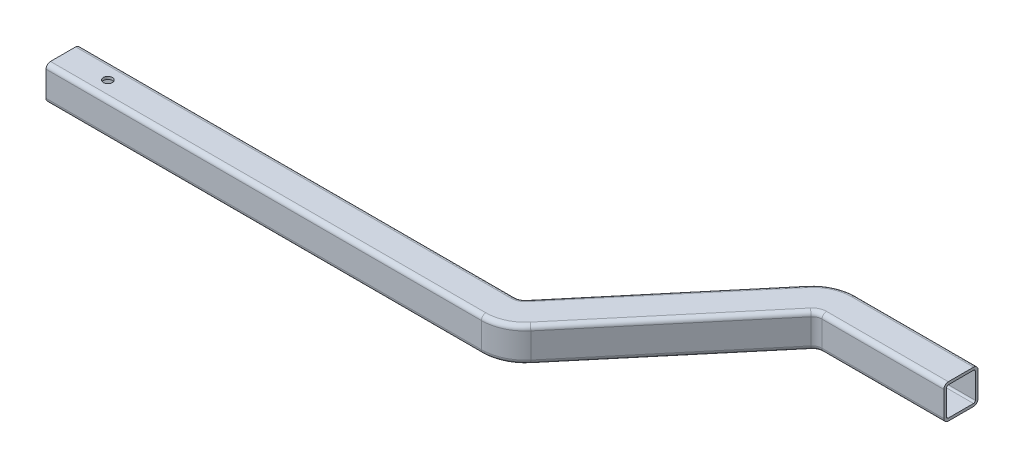
from build123d import *

# Parameters (mm, degrees)
CUT_EXTRUDE3_DEPTH      = 838.811644413
CUT_EXTRUDE3_DEPTH_BACK = 838.811644413
SKETCH21_R              = 5


with BuildPart() as part:
    # Sweep-Thin3: sweep along a curve in space
    with BuildLine() as sweep_thin3_path:
        Line((674.686132166, 0, -191.51111078), (810.696902422, 0, -191.51111078))
        ThreePointArc((651.704798873, 0, -180.79473907), (662.007584314, 0, -188.700344391), (674.686132166, 0, -191.51111078))
        Line((508.992103549, 0, -10.716371709), (651.704798873, 0, -180.79473907))
        ThreePointArc((486.010770255, 0, 0), (498.689318108, 0, -2.810766389), (508.992103549, 0, -10.716371709))
        Line((0, 0, 0), (486.010770255, 0, 0))
    # Sketch2 → Sweep-Thin3 (sweep)
    with BuildSketch(Plane(origin=(0, 0, 0), x_dir=(0, 0, -1), z_dir=(1, 0, 0))):
        with BuildLine():
            Line((14.05, 19.05), (-14.05, 19.05))
            ThreePointArc((-14.05, 19.05), (-17.585533906, 17.585533906), (-19.05, 14.05))
            Line((-19.05, 14.05), (-19.05, -14.05))
            ThreePointArc((-19.05, -14.05), (-17.585533906, -17.585533906), (-14.05, -19.05))
            Line((-14.05, -19.05), (14.05, -19.05))
            ThreePointArc((14.05, -19.05), (17.585533906, -17.585533906), (19.05, -14.05))
            Line((19.05, -14.05), (19.05, 14.05))
            ThreePointArc((19.05, 14.05), (17.585533906, 17.585533906), (14.05, 19.05))
        make_face()
        with BuildLine():
            Line((14.05, 16.05), (-14.05, 16.05))
            ThreePointArc((-14.05, 16.05), (-15.464213562, 15.464213562), (-16.05, 14.05))
            Line((-16.05, 14.05), (-16.05, -14.05))
            ThreePointArc((-16.05, -14.05), (-15.464213562, -15.464213562), (-14.05, -16.05))
            Line((-14.05, -16.05), (14.05, -16.05))
            ThreePointArc((14.05, -16.05), (15.464213562, -15.464213562), (16.05, -14.05))
            Line((16.05, -14.05), (16.05, 14.05))
            ThreePointArc((16.05, 14.05), (15.464213562, 15.464213562), (14.05, 16.05))
        make_face(mode=Mode.SUBTRACT)
    sweep(path=sweep_thin3_path.line)

    # Sketch21 → Cut-Extrude3 (cut, two sides: drawn at the far end of the back side and taken through both)
    with BuildSketch(Plane(origin=(0, 0, 0), x_dir=(1, 0, 0), z_dir=(0, 1, 0)).offset(-CUT_EXTRUDE3_DEPTH_BACK)):
        with Locations((50, 0)):
            Circle(SKETCH21_R)
    extrude(amount=CUT_EXTRUDE3_DEPTH + CUT_EXTRUDE3_DEPTH_BACK, mode=Mode.SUBTRACT)


solid = part.part
